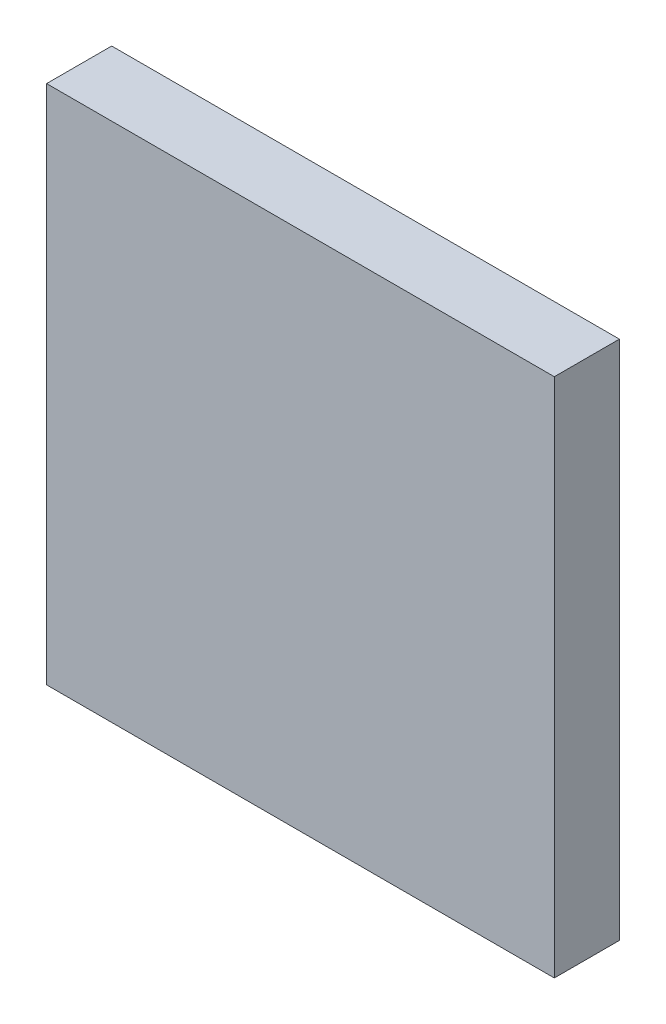
from build123d import *

# Parameters (mm, degrees)
IZIM1_W            = 390
IZIM1_H            = 400
TABAN_FLAN_1_DEPTH = 50


# Sheet-metal steps are written as plain solids
with BuildPart() as part:
    # Çizim1 → Taban-Flanş1 (new body)
    with BuildSketch(Plane.XY):
        with Locations((195, -200)):
            Rectangle(IZIM1_W, IZIM1_H)
    extrude(amount=-TABAN_FLAN_1_DEPTH)


solid = part.part
